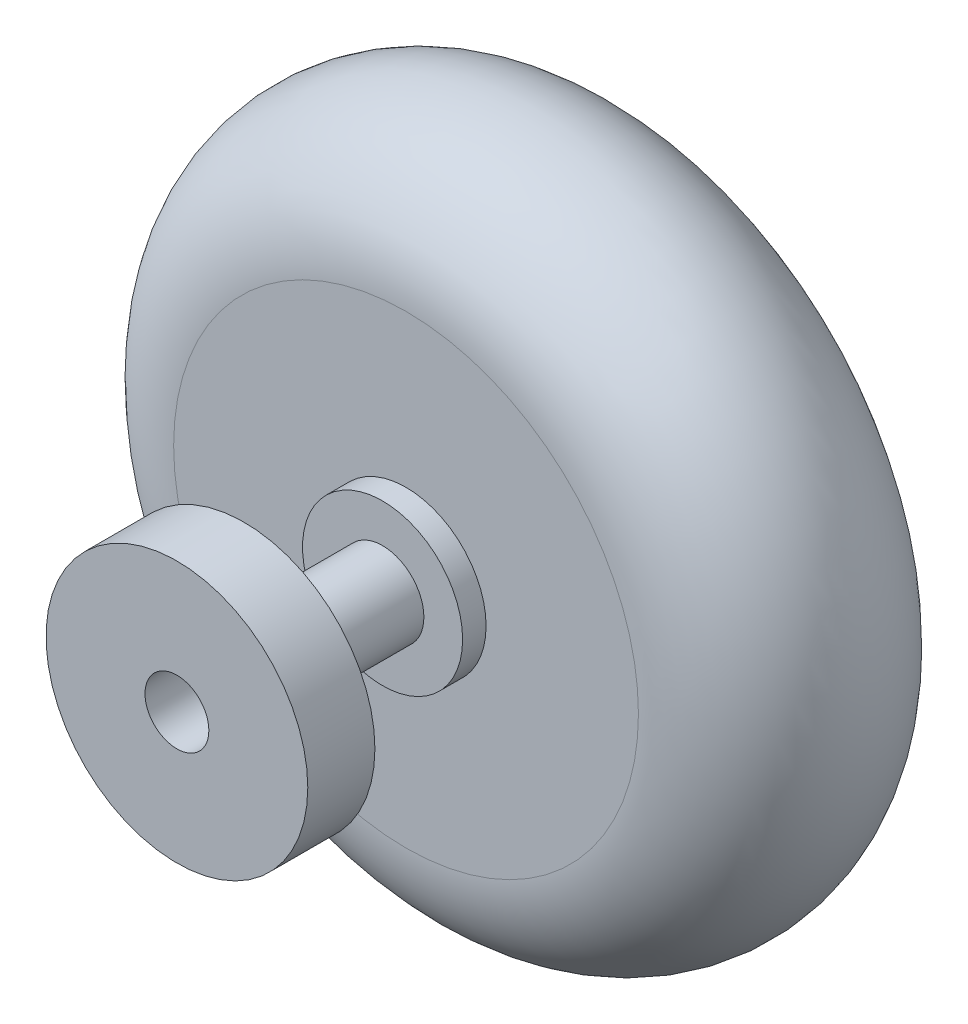
from build123d import *

# Parameters (mm, degrees)
SKETCH1_R           = 14.9
BOSS_EXTRUDE1_DEPTH = 10
FILLET1_R           = 5
SKETCH3_R           = 3.41
BOSS_EXTRUDE2_DEPTH = 1
SKETCH4_R           = 1.76
BOSS_EXTRUDE3_DEPTH = 5.9
SKETCH5_R           = 5.575
BOSS_EXTRUDE4_DEPTH = 2.86
SKETCH6_R           = 1.36
CUT_EXTRUDE1_DEPTH  = 2.86
SKETCH7_R           = 3.405
BOSS_EXTRUDE5_DEPTH = 0.5
SKETCH8_R           = 1.79
BOSS_EXTRUDE6_DEPTH = 1.92
SKETCH9_R           = 2.85
BOSS_EXTRUDE7_DEPTH = 1.12
SKETCH10_R          = 1.11
BOSS_EXTRUDE8_DEPTH = 1.5
BOSS_EXTRUDE8_TAPER = 5
SKETCH11_R          = 0.76
BOSS_EXTRUDE9_DEPTH = 2.24


with BuildPart() as part:
    # Sketch1 → Boss-Extrude1 (new body)
    with BuildSketch(Plane.XY):
        Circle(SKETCH1_R)
    extrude(amount=-BOSS_EXTRUDE1_DEPTH)

    # Fillet1
    fillet1_edges = [part.edges().sort_by_distance(p)[0] for p in [
        (-14.9, 0, 0),
        (-14.9, 0, -10),
    ]]
    fillet(fillet1_edges, radius=FILLET1_R - 0.0001)  # a hair under: the kernel refuses the full size

    # Sketch3 → Boss-Extrude2 (add)
    with BuildSketch(Plane.XY):
        Circle(SKETCH3_R)
    extrude(amount=BOSS_EXTRUDE2_DEPTH)

    # Sketch4 → Boss-Extrude3 (add)
    with BuildSketch(Plane.XY.offset(1)):
        Circle(SKETCH4_R)
    extrude(amount=BOSS_EXTRUDE3_DEPTH)

    # Sketch5 → Boss-Extrude4 (add)
    with BuildSketch(Plane.XY.offset(6.9)):
        Circle(SKETCH5_R)
    extrude(amount=BOSS_EXTRUDE4_DEPTH)

    # Sketch6 → Cut-Extrude1 (cut)
    with BuildSketch(Plane.XY.offset(9.76)):
        Circle(SKETCH6_R)
    extrude(amount=-CUT_EXTRUDE1_DEPTH, mode=Mode.SUBTRACT)

    # Sketch7 → Boss-Extrude5 (add)
    with BuildSketch(Plane(origin=(0, 0, -10), x_dir=(-1, 0, 0), z_dir=(0, 0, -1))):
        with Locations(Location((0, 0, 0), (0, 0, 180))):
            Circle(SKETCH7_R)
    extrude(amount=BOSS_EXTRUDE5_DEPTH)

    # Sketch8 → Boss-Extrude6 (add)
    with BuildSketch(Plane(origin=(0, 0, -10.5), x_dir=(-1, 0, 0), z_dir=(0, 0, -1))):
        Circle(SKETCH8_R)
    extrude(amount=BOSS_EXTRUDE6_DEPTH)

    # Sketch9 → Boss-Extrude7 (add)
    with BuildSketch(Plane(origin=(0, 0, -12.42), x_dir=(-1, 0, 0), z_dir=(0, 0, -1))):
        Circle(SKETCH9_R)
    extrude(amount=BOSS_EXTRUDE7_DEPTH)

    # Sketch10 → Boss-Extrude8 (add)
    with BuildSketch(Plane(origin=(0, 0, -13.54), x_dir=(-1, 0, 0), z_dir=(0, 0, -1))):
        Circle(SKETCH10_R)
    extrude(amount=BOSS_EXTRUDE8_DEPTH, taper=BOSS_EXTRUDE8_TAPER)

    # Sketch11 → Boss-Extrude9 (add)
    with BuildSketch(Plane(origin=(0, 0, -15.04), x_dir=(-1, 0, 0), z_dir=(0, 0, -1))):
        Circle(SKETCH11_R)
    extrude(amount=BOSS_EXTRUDE9_DEPTH)


solid = part.part
